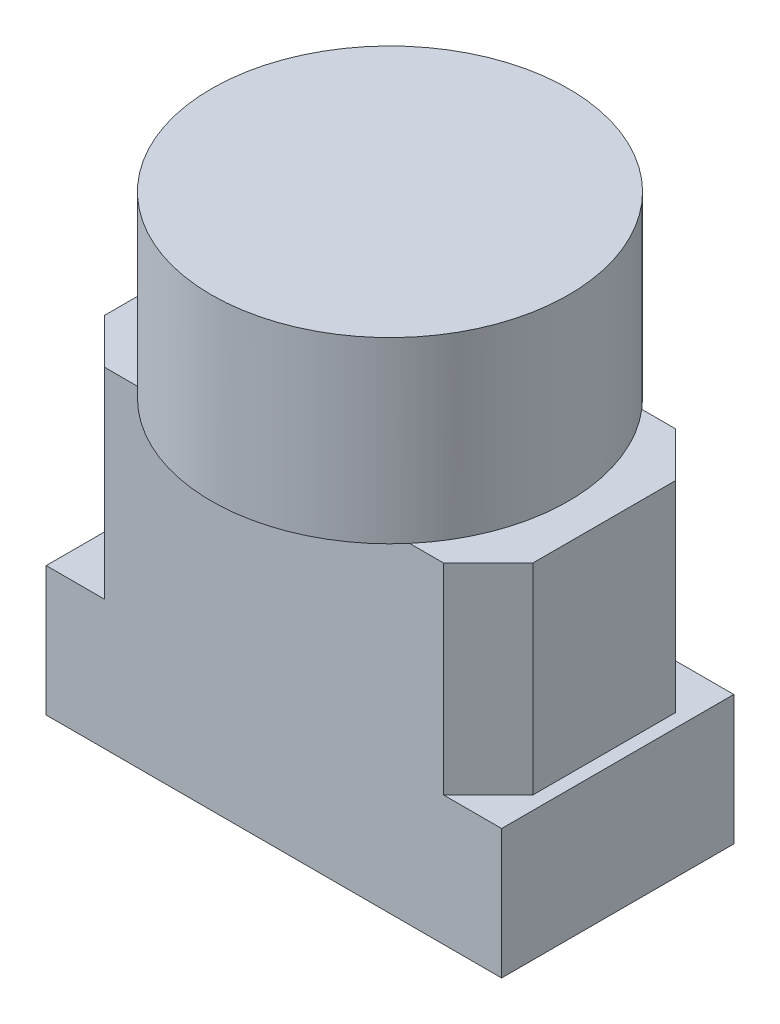
from build123d import *

# Parameters (mm, degrees)
SKETCH1_R           = 40
BOSS_EXTRUDE1_DEPTH = 40
SKETCH2_W           = 96
SKETCH2_H           = 52
BOSS_EXTRUDE2_DEPTH = 45
CHAMFER1_SIZE       = 10
SKETCH4_W           = 102
SKETCH4_H           = 52
BOSS_EXTRUDE3_DEPTH = 33
CHAMFER2_SIZE       = 4


with BuildPart() as part:
    # Sketch1 → Boss-Extrude1 (new body)
    with BuildSketch(Plane(origin=(0, 0, 0), x_dir=(1, 0, 0), z_dir=(0, 1, 0))):
        Circle(SKETCH1_R)
    extrude(amount=BOSS_EXTRUDE1_DEPTH)

    # Sketch2 → Boss-Extrude2 (add)
    with BuildSketch(Plane.XZ):
        Rectangle(SKETCH2_W, SKETCH2_H)
    extrude(amount=BOSS_EXTRUDE2_DEPTH)

    # Chamfer1
    chamfer1_edges = [part.edges().sort_by_distance(p)[0] for p in [
        (-48, -22.5, 26),
        (48, -22.5, 26),
        (-48, -22.5, -26),
        (48, -22.5, -26),
    ]]
    chamfer(chamfer1_edges, length=CHAMFER1_SIZE)

    # Sketch4 → Boss-Extrude3 (add)
    with BuildSketch(Plane(origin=(0, -45, 0), x_dir=(-1, 0, 0), z_dir=(0, -1, 0))):
        Rectangle(SKETCH4_W, SKETCH4_H)
    extrude(amount=BOSS_EXTRUDE3_DEPTH)

    # Chamfer2
    chamfer2_edges = [part.edges().sort_by_distance(p)[0] for p in [
        (51, -78, 0),
        (0, -78, 26),
        (-51, -78, 0),
        (0, -78, -26),
    ]]
    chamfer(chamfer2_edges, length=CHAMFER2_SIZE)


solid = part.part
